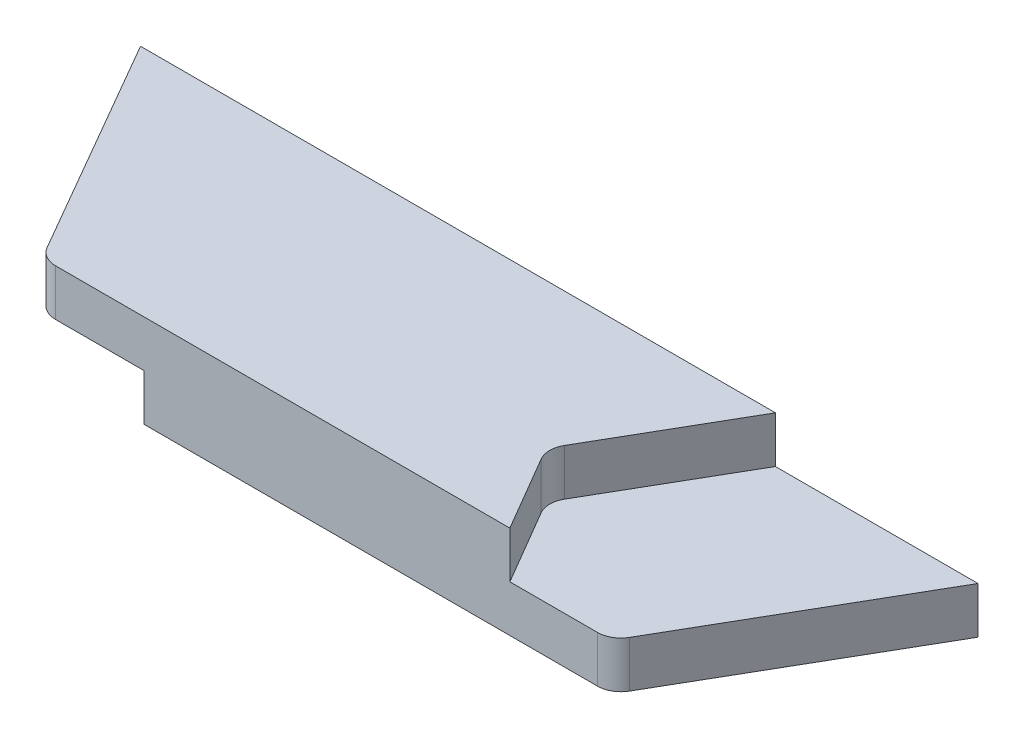
from build123d import *

# Parameters (mm, degrees)
SKETCH_1_W          = 50
SKETCH_1_H          = 20
EXTRUDE_1_DEPTH     = 180
CUT_EXTRUDE_1_DEPTH = 10
CUT_EXTRUDE_2_DEPTH = 10
SKETCH_4_OUTSIDE_W  = 219.576
SKETCH_4_OUTSIDE_H  = 89.576
CUT_EXTRUDE_4_DEPTH = 188.882942281


with BuildPart() as part:
    # Эскиз1 → Бобышка-Вытянуть1 (new body)
    with BuildSketch(Plane(origin=(0, 0, 0), x_dir=(0, 0, -1), z_dir=(1, 0, 0))):
        with Locations((25, 10)):
            Rectangle(SKETCH_1_W, SKETCH_1_H)
    extrude(amount=EXTRUDE_1_DEPTH)

    # Эскиз2 → Вырез-Вытянуть1 (cut)
    with BuildSketch(Plane.XZ):
        with BuildLine():
            Line((43.517527849, -50), (0, -50))
            Line((0, -50), (0, 0))
            Line((0, 0), (50.69898236, 0))
            Line((50.69898236, 0), (60.088568146, -16.308535178))
            ThreePointArc((60.088568146, -16.308535178), (60.755434633, -18.806330829), (60.085562557, -21.303322104))
            Line((60.085562557, -21.303322104), (43.517527849, -50))
        make_face()
    extrude(amount=-CUT_EXTRUDE_1_DEPTH, mode=Mode.SUBTRACT)

    # Эскиз3 → Вырез-Вытянуть2 (cut)
    with BuildSketch(Plane(origin=(0, 20, 0), x_dir=(1, 0, 0), z_dir=(0, 1, 0))):
        with BuildLine():
            Line((119.870060572, 21.260602823), (136.462759268, 50))
            Line((136.462759268, 50), (180, 50))
            Line((180, 50), (180, 0))
            Line((180, 0), (129.384239064, 0))
            Line((129.384239064, 0), (119.884637949, 16.23552237))
            ThreePointArc((119.884637949, 16.23552237), (119.200208629, 18.746098263), (119.870060572, 21.260602823))
        make_face()
    extrude(amount=-CUT_EXTRUDE_2_DEPTH, mode=Mode.SUBTRACT)

    # Эскиз4 outside → Вырез-Вытянуть4 (cut, through all)
    with BuildSketch(Plane(origin=(0, 20, 0), x_dir=(1, 0, 0), z_dir=(0, 1, 0))):
        with Locations((90, 25)):
            Rectangle(SKETCH_4_OUTSIDE_W, SKETCH_4_OUTSIDE_H)
        with BuildLine():
            Line((180, 50), (152.575862213, 2.5))
            ThreePointArc((152.575862213, 2.5), (150.745735195, 0.669872981), (148.245735195, 0))
            Line((148.245735195, 0), (31.754264805, 0))
            ThreePointArc((31.754264805, 0), (29.254264805, 0.669872981), (27.424137787, 2.5))
            Line((27.424137787, 2.5), (0, 50))
            Line((0, 50), (180, 50))
        make_face(mode=Mode.SUBTRACT)
    extrude(amount=-CUT_EXTRUDE_4_DEPTH, mode=Mode.SUBTRACT)


solid = part.part
